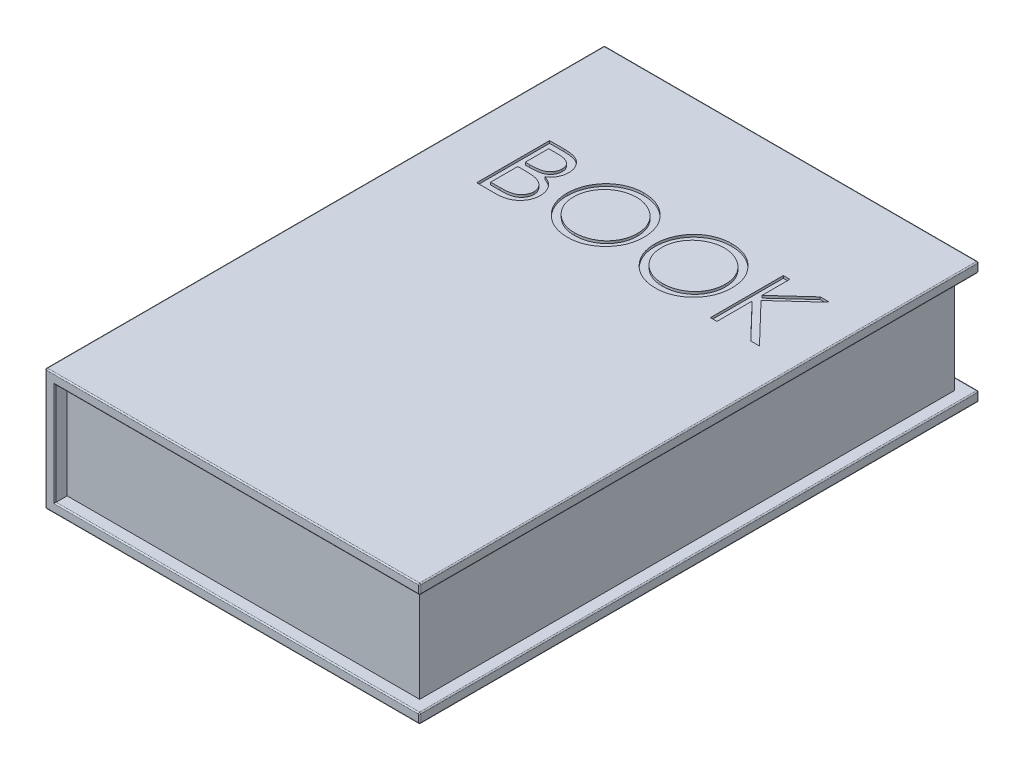
from build123d import *

# Parameters (mm, degrees)
CROQUIS1_W              = 150
CROQUIS1_H              = 230
SALIENTE_EXTRUIR1_DEPTH = 4
CROQUIS2_W              = 230
CROQUIS2_H              = 50
SALIENTE_EXTRUIR2_DEPTH = 4
CROQUIS3_W              = 145
CROQUIS3_H              = 220
SALIENTE_EXTRUIR3_DEPTH = 42
CROQUIS4_W              = 154
CROQUIS4_H              = 230
SALIENTE_EXTRUIR4_DEPTH = 4
REDONDEO1_R             = 0.5
ENVOLVER1_START         = -1
ENVOLVER1_DEPTH         = 1


# Read off the part's stored shape, not the designer's step: Envolver1
with BuildPart() as part:
    # Croquis1 → Saliente-Extruir1 (new body)
    with BuildSketch(Plane(origin=(0, 0, 0), x_dir=(1, 0, 0), z_dir=(0, 1, 0))):
        Rectangle(CROQUIS1_W, CROQUIS1_H)
    extrude(amount=SALIENTE_EXTRUIR1_DEPTH)

    # Croquis2 → Saliente-Extruir2 (add)
    with BuildSketch(Plane.ZY.offset(75)):
        with Locations((0, 25)):
            Rectangle(CROQUIS2_W, CROQUIS2_H)
    extrude(amount=SALIENTE_EXTRUIR2_DEPTH)

    # Croquis4 → Saliente-Extruir4 (add)
    with BuildSketch(Plane(origin=(0, 50, 0), x_dir=(1, 0, 0), z_dir=(0, 1, 0))):
        with Locations((-2, 0)):
            Rectangle(CROQUIS4_W, CROQUIS4_H)
    extrude(amount=-SALIENTE_EXTRUIR4_DEPTH)

    # Redondeo1
    redondeo1_edges = [part.edges().sort_by_distance(p)[0] for p in [
        (0, 4, -115),
        (-75, 25, -115),
        (0, 46, -115),
        (0, 46, 115),
        (-75, 25, 115),
        (0, 4, 115),
        (75, 2, 115),
        (75, 4, 0),
        (75, 2, -115),
        (75, 48, -115),
        (75, 46, 0),
        (75, 48, 115),
        (-79, 25, 115),
        (-79, 25, -115),
        (-2, 0, -115),
        (-79, 0, 0),
        (-2, 0, 115),
        (75, 0, 0),
        (-79, 50, 0),
        (-2, 50, -115),
        (75, 50, 0),
        (-2, 50, 115),
    ]]
    fillet(redondeo1_edges, radius=REDONDEO1_R)

    # Envolver1 outline → Envolver1 (cut)
    # profile 1 of 4: a face of its own
    with BuildSketch(Plane(origin=(0, 50, 0), x_dir=(1, 0, 0), z_dir=(0, 1, 0)).offset(ENVOLVER1_START)):
        with BuildLine():
            add(Edge.make_bspline(
                [(-50.497714302, 69.806907736), (-50.211184489, 69.805401304), (-49.6558184, 69.802481464), (-48.848223185, 69.757197483), (-48.091804808, 69.695451741), (-47.386343902, 69.597479518), (-46.732166453, 69.479264286), (-46.127300991, 69.336105862), (-45.573670943, 69.164449174), (-44.912704631, 68.891481049), (-44.159098966, 68.485853891), (-43.343112743, 67.88646619), (-42.64536212, 67.153330792), (-42.043765115, 66.326336603), (-41.565469804, 65.416601416), (-41.219447255, 64.44580837), (-41.000379752, 63.426479153), (-40.977850316, 62.726680486), (-40.966464302, 62.373013506)],
                knots=[0, 0, 0, 0, 0.062594097, 0.121322939, 0.176680142, 0.228365096, 0.276868446, 0.321879128, 0.364098625, 0.403355696, 0.477967948, 0.550535461, 0.623584457, 0.698174882, 0.77335367, 0.847281125, 0.92281834, 1, 1, 1, 1], degree=3))
            Line((-50.497714302, 69.806907736), (-56.351079687, 69.806907736))
            Line((-56.351079687, 69.806907736), (-56.351079687, 39.806907736))
            Line((-56.351079687, 39.806907736), (-48.238098917, 39.806907736))
            add(Edge.make_bspline(
                [(-38.658771994, 48.322532736), (-38.66714496, 48.029673832), (-38.683619005, 47.453465734), (-38.805161621, 46.606993153), (-39.010953966, 45.798065039), (-39.294420935, 45.021449187), (-39.664383632, 44.278648034), (-40.114623326, 43.568820057), (-40.6514653, 42.899097224), (-41.252004176, 42.262037597), (-41.931393995, 41.689227991), (-42.66438618, 41.179093362), (-43.460211779, 40.759555687), (-44.305800299, 40.407132646), (-45.210637295, 40.137928087), (-46.170659643, 39.94959174), (-47.185039373, 39.822691423), (-47.881122954, 39.812258238), (-48.238098917, 39.806907736)],
                knots=[0, 0, 0, 0, 0.061160277, 0.120334558, 0.178180255, 0.235235126, 0.292682961, 0.351186248, 0.41045661, 0.471719854, 0.533761203, 0.595739024, 0.657887515, 0.72129518, 0.786822515, 0.854686154, 0.925477986, 1, 1, 1, 1], degree=3))
            add(Edge.make_bspline(
                [(-44.434012379, 55.990801967), (-44.093208714, 55.859959119), (-43.441166879, 55.609624339), (-42.543858201, 55.167034647), (-41.77075953, 54.685645129), (-41.11592685, 54.159943557), (-40.555889808, 53.593296607), (-40.066864594, 52.977395628), (-39.649595673, 52.304206275), (-39.292056328, 51.5807474), (-39.013066991, 50.814406243), (-38.804130667, 50.012371019), (-38.684409675, 49.177517689), (-38.66737275, 48.609357295), (-38.658771994, 48.322532736)],
                knots=[0, 0, 0, 0, 0.106057493, 0.202914257, 0.290300165, 0.370222566, 0.446383721, 0.5213969, 0.598291083, 0.676142469, 0.7555287, 0.834887172, 0.916646049, 1, 1, 1, 1], degree=3))
            add(Edge.make_bspline(
                [(-40.966464302, 62.373013506), (-40.975834746, 62.041705885), (-40.994248551, 61.390655168), (-41.170329346, 60.438419946), (-41.445992218, 59.531980927), (-41.829180068, 58.674646195), (-42.327197178, 57.885786654), (-42.917411338, 57.159038659), (-43.629498217, 56.525172456), (-44.163011702, 56.17080472), (-44.434012379, 55.990801967)],
                knots=[0, 0, 0, 0, 0.130569107, 0.256580609, 0.380551617, 0.503622917, 0.625739323, 0.747548582, 0.871766119, 1, 1, 1, 1], degree=3))
        make_face()
        with BuildLine():
            add(Edge.make_bspline(
                [(-49.824637379, 42.883830813), (-49.550189442, 42.887120077), (-49.021227226, 42.893459698), (-48.257502396, 42.91415588), (-47.549647221, 42.961232529), (-46.900891772, 43.035339812), (-46.304230749, 43.115726519), (-45.766821866, 43.223823213), (-45.284308779, 43.347671446), (-44.724814713, 43.539107208), (-44.094784642, 43.83650553), (-43.415834445, 44.284913185), (-42.812181146, 44.819112966), (-42.299564639, 45.437377944), (-41.879453308, 46.109646461), (-41.573835122, 46.822320889), (-41.385342064, 47.56362541), (-41.36252347, 48.069054375), (-41.351079687, 48.322532736)],
                knots=[0, 0, 0, 0, 0.072502489, 0.139738989, 0.201795135, 0.259821934, 0.312205989, 0.360773434, 0.404540343, 0.443698099, 0.516840794, 0.587874336, 0.657965418, 0.728969389, 0.79930772, 0.866635778, 0.933116329, 1, 1, 1, 1], degree=3))
            Line((-49.824637379, 42.883830813), (-53.658771994, 42.883830813))
            Line((-53.658771994, 42.883830813), (-53.658771994, 54.037676967))
            Line((-53.658771994, 54.037676967), (-51.873916225, 54.037676967))
            add(Edge.make_bspline(
                [(-46.260935456, 53.683109659), (-46.406899135, 53.712724665), (-46.723378497, 53.776936105), (-47.239443473, 53.84471642), (-47.828608063, 53.905102647), (-48.492232725, 53.949769713), (-49.231157078, 53.995940086), (-50.046959238, 54.013895696), (-50.936307649, 54.035317925), (-51.553385127, 54.036870505), (-51.873916225, 54.037676967)],
                knots=[0, 0, 0, 0, 0.079306486, 0.171952819, 0.277056507, 0.394730576, 0.526177321, 0.671344767, 0.829285257, 1, 1, 1, 1], degree=3))
            add(Edge.make_bspline(
                [(-41.351079687, 48.322532736), (-41.353446295, 48.481047084), (-41.358141339, 48.795518928), (-41.42894661, 49.257654521), (-41.531922636, 49.705304863), (-41.665049212, 50.139685496), (-41.858930359, 50.552943007), (-42.085272173, 50.953250661), (-42.350655616, 51.341137627), (-42.764177038, 51.831528371), (-43.365651191, 52.396531339), (-44.220280695, 52.94970993), (-45.192043249, 53.39583399), (-45.896850331, 53.585258073), (-46.260935456, 53.683109659)],
                knots=[0, 0, 0, 0, 0.060287398, 0.119602355, 0.177503371, 0.235142664, 0.292132593, 0.350871209, 0.410097863, 0.470731522, 0.594828704, 0.722578824, 0.85669139, 1, 1, 1, 1], degree=3))
        make_face(mode=Mode.SUBTRACT)
        with BuildLine():
            add(Edge.make_bspline(
                [(-51.849877763, 57.114600044), (-51.585459517, 57.118027956), (-51.074549581, 57.124651379), (-50.334664753, 57.143624382), (-49.647878883, 57.196750469), (-49.015377457, 57.249861287), (-48.438156508, 57.336214895), (-47.917494838, 57.43900452), (-47.44522115, 57.547715135), (-46.900596474, 57.732596451), (-46.282828345, 58.005833667), (-45.624258881, 58.429877977), (-45.043677713, 58.934943861), (-44.553416104, 59.517723534), (-44.152174928, 60.159433698), (-43.873485941, 60.84983553), (-43.684509219, 61.571722376), (-43.66743895, 62.0673074), (-43.658771994, 62.318926967)],
                knots=[0, 0, 0, 0, 0.072301034, 0.139700332, 0.202288511, 0.260599533, 0.313190329, 0.361738933, 0.405706476, 0.445539985, 0.518831956, 0.58977824, 0.658867479, 0.728430478, 0.797282704, 0.864815377, 0.931363753, 1, 1, 1, 1], degree=3))
            Line((-51.849877763, 57.114600044), (-53.658771994, 57.114600044))
            Line((-53.658771994, 57.114600044), (-53.658771994, 66.729984659))
            Line((-53.658771994, 66.729984659), (-50.00492584, 66.729984659))
            add(Edge.make_bspline(
                [(-43.658771994, 62.318926967), (-43.66328211, 62.48543358), (-43.672129195, 62.812054484), (-43.744586074, 63.288191805), (-43.867736712, 63.735995398), (-44.025916369, 64.161602058), (-44.246962272, 64.551703631), (-44.507220529, 64.919788166), (-44.821669303, 65.25332061), (-45.179589126, 65.565059167), (-45.591091607, 65.841440834), (-46.055931251, 66.083504518), (-46.580397055, 66.278425461), (-47.155650097, 66.44913534), (-47.790545133, 66.569035001), (-48.477755591, 66.668921181), (-49.222910325, 66.719773255), (-49.738439776, 66.726504937), (-50.00492584, 66.729984659)],
                knots=[0, 0, 0, 0, 0.057003133, 0.111817869, 0.164402372, 0.215869805, 0.26684111, 0.317478963, 0.369902136, 0.423400449, 0.479718398, 0.539241497, 0.602430689, 0.671029546, 0.744484798, 0.823453971, 0.908740313, 1, 1, 1, 1], degree=3))
        make_face(mode=Mode.SUBTRACT)
    # profile 2 of 4: a face of its own
    with BuildSketch(Plane(origin=(0, 50, 0), x_dir=(1, 0, 0), z_dir=(0, 1, 0)).offset(ENVOLVER1_START)):
        with BuildLine():
            add(Edge.make_bspline(
                [(-2.50492584, 54.818926967), (-2.518210976, 54.279291713), (-2.544397518, 53.215608109), (-2.768701326, 51.654378587), (-3.120481326, 50.153601189), (-3.622735036, 48.715781308), (-4.267524851, 47.33940219), (-5.061712032, 46.028085443), (-5.997208124, 44.781401171), (-7.061838276, 43.613006897), (-8.222418636, 42.541600006), (-9.467249494, 41.608009643), (-10.768335094, 40.804660003), (-12.142418307, 40.163657084), (-13.571275765, 39.651326337), (-15.067695677, 39.302018079), (-16.62466614, 39.076700566), (-17.686417602, 39.050827572), (-18.226079687, 39.037676967)],
                knots=[0, 0, 0, 0, 0.065226504, 0.128568996, 0.190320378, 0.251377989, 0.312387528, 0.373788704, 0.43643116, 0.500566755, 0.564686795, 0.627135518, 0.688455409, 0.749245746, 0.810155177, 0.871670926, 0.934773496, 1, 1, 1, 1], degree=3))
            add(Edge.make_bspline(
                [(-18.466464302, 70.576138506), (-17.910966251, 70.562068682), (-16.819922249, 70.534434389), (-15.216423125, 70.322899216), (-13.685608023, 69.95693873), (-12.215006833, 69.469541737), (-10.822209891, 68.819361291), (-9.49673367, 68.033488591), (-8.241731894, 67.103690373), (-7.074120053, 66.037154143), (-6.005631907, 64.876724538), (-5.064267168, 63.638342452), (-4.275333222, 62.329495575), (-3.627455046, 60.954117027), (-3.119181249, 59.515317301), (-2.768446588, 58.005425849), (-2.544405301, 56.434225648), (-2.518212924, 55.362566808), (-2.50492584, 54.818926967)],
                knots=[0, 0, 0, 0, 0.066570035, 0.130749041, 0.1934128, 0.254989399, 0.316113556, 0.377261758, 0.439400784, 0.502970589, 0.566524976, 0.628231103, 0.689090611, 0.749344669, 0.810169593, 0.871609824, 0.934869184, 1, 1, 1, 1], degree=3))
            add(Edge.make_bspline(
                [(-34.043387379, 54.674696198), (-34.038804789, 55.031547648), (-34.02969742, 55.740748706), (-33.920054342, 56.793890993), (-33.760954046, 57.830096631), (-33.532937652, 58.846419042), (-33.234723364, 59.84037034), (-32.882848844, 60.81880545), (-32.45307874, 61.771808796), (-31.967244614, 62.703895011), (-31.425000546, 63.600534204), (-30.82606555, 64.448073488), (-30.191476678, 65.253624889), (-29.495790447, 65.996313493), (-28.761935202, 66.697744834), (-27.978006247, 67.347139551), (-27.148787009, 67.950353416), (-26.270709468, 68.49395634), (-25.365409969, 68.985606065), (-24.432180446, 69.407507645), (-23.483695547, 69.769616744), (-22.515512851, 70.063109531), (-21.530203376, 70.294812697), (-20.525616651, 70.452590014), (-19.502552997, 70.562512739), (-18.81331312, 70.571577042), (-18.466464302, 70.576138506)],
                knots=[0, 0, 0, 0, 0.043208986, 0.085872872, 0.128120007, 0.170151964, 0.211917621, 0.253753003, 0.296006409, 0.338443357, 0.381015368, 0.422820479, 0.464089056, 0.505125849, 0.545974971, 0.586985211, 0.628338592, 0.670083802, 0.711991602, 0.753039155, 0.794049395, 0.834885543, 0.875498313, 0.9165473, 0.958003779, 1, 1, 1, 1], degree=3))
            add(Edge.make_bspline(
                [(-18.226079687, 39.037676967), (-18.769716706, 39.050957426), (-19.841369986, 39.077136745), (-21.414544575, 39.301548786), (-22.925496665, 39.652474248), (-24.36990539, 40.153983701), (-25.748576215, 40.802131393), (-27.064205495, 41.592454642), (-28.311512471, 42.530230138), (-29.480156013, 43.594515063), (-30.549434854, 44.753128366), (-31.481658074, 45.994564838), (-32.272159046, 47.294468752), (-32.918130467, 48.65644753), (-33.429540119, 50.073917039), (-33.77843856, 51.55633256), (-34.004175292, 53.09524261), (-34.030188262, 54.143038881), (-34.043387379, 54.674696198)],
                knots=[0, 0, 0, 0, 0.065818877, 0.129746527, 0.192071954, 0.253459424, 0.314569588, 0.376279881, 0.439025654, 0.503267029, 0.567492823, 0.629704796, 0.690999649, 0.751451651, 0.812004364, 0.873149681, 0.935635484, 1, 1, 1, 1], degree=3))
        make_face()
        with BuildLine():
            add(Edge.make_bspline(
                [(-31.351079687, 54.686715429), (-31.340152298, 54.253324965), (-31.318654745, 53.400711848), (-31.130447001, 52.151270615), (-30.840544363, 50.950513875), (-30.413195508, 49.805011795), (-29.878761668, 48.704917942), (-29.21853118, 47.659991331), (-28.436310447, 46.66994955), (-27.547765933, 45.741704388), (-26.576428448, 44.894454637), (-25.545005048, 44.150768277), (-24.464545556, 43.521537565), (-23.332232389, 43.008922658), (-22.154110626, 42.602724906), (-20.92258876, 42.324336639), (-19.645870535, 42.14111845), (-18.775607777, 42.123523399), (-18.334252763, 42.114600044)],
                knots=[0, 0, 0, 0, 0.064503999, 0.126899322, 0.18774654, 0.248149733, 0.308586065, 0.369583005, 0.431826965, 0.496179723, 0.560667855, 0.623504455, 0.685260411, 0.746536822, 0.808327352, 0.870486188, 0.934316883, 1, 1, 1, 1], degree=3))
            add(Edge.make_bspline(
                [(-18.334252763, 67.499215429), (-18.618949622, 67.495744941), (-19.185621619, 67.488837143), (-20.028060501, 67.397845295), (-20.859419934, 67.268160533), (-21.67987161, 67.083176069), (-22.485982662, 66.831141331), (-23.285267014, 66.541076404), (-24.070436048, 66.18775277), (-24.838897686, 65.788558161), (-25.583884045, 65.346710268), (-26.286850057, 64.858380837), (-26.949615577, 64.3350218), (-27.570557863, 63.775411766), (-28.147853624, 63.176700893), (-28.692865351, 62.547965726), (-29.183747479, 61.871235232), (-29.633623852, 61.164860316), (-30.03620534, 60.429761048), (-30.394194095, 59.673676515), (-30.687028456, 58.890439199), (-30.925848824, 58.08854642), (-31.123847203, 57.269268194), (-31.249280838, 56.42638949), (-31.34127249, 55.564145673), (-31.347785451, 54.981444067), (-31.351079687, 54.686715429)],
                knots=[0, 0, 0, 0, 0.042023329, 0.083644911, 0.124983795, 0.166247461, 0.207701556, 0.249631071, 0.29174177, 0.334742875, 0.377460169, 0.419556319, 0.461044176, 0.502096284, 0.542890714, 0.583800819, 0.624863583, 0.666224689, 0.707399186, 0.748556678, 0.789654591, 0.830739726, 0.872070142, 0.913993395, 0.95649813, 1, 1, 1, 1], degree=3))
            add(Edge.make_bspline(
                [(-5.197233533, 54.824936583), (-5.200671644, 55.115640905), (-5.207491771, 55.692306478), (-5.297855839, 56.544827778), (-5.427292042, 57.378426733), (-5.61382954, 58.189830759), (-5.854259429, 58.979246688), (-6.150722261, 59.745933097), (-6.500310542, 60.492746198), (-6.901523894, 61.217840172), (-7.352516667, 61.913623641), (-7.845324466, 62.578787177), (-8.388456022, 63.200839245), (-8.966393378, 63.795136622), (-9.593572395, 64.349004248), (-10.267152059, 64.862625853), (-10.978955011, 65.348396776), (-11.732617029, 65.786615877), (-12.510422346, 66.191309301), (-13.308541986, 66.538032185), (-14.117934269, 66.832650351), (-14.936540946, 67.083938623), (-15.771252189, 67.267436024), (-16.616427865, 67.397962166), (-17.470898652, 67.488805473), (-18.045554821, 67.495734432), (-18.334252763, 67.499215429)],
                knots=[0, 0, 0, 0, 0.042915082, 0.085129971, 0.126473319, 0.167453038, 0.207976333, 0.248249378, 0.288749987, 0.329669857, 0.370537287, 0.411128564, 0.451818913, 0.492405877, 0.533485862, 0.575263062, 0.617440613, 0.660671688, 0.703940204, 0.746867522, 0.7890793, 0.831104042, 0.87323799, 0.91516577, 0.957380658, 1, 1, 1, 1], degree=3))
            add(Edge.make_bspline(
                [(-18.334252763, 42.114600044), (-18.037599892, 42.118675796), (-17.449248152, 42.126759236), (-16.574143675, 42.208176466), (-15.714804717, 42.338735346), (-14.872436604, 42.526712394), (-14.047995363, 42.761974164), (-13.238039908, 43.041468975), (-12.45119742, 43.390165006), (-11.677541667, 43.775433163), (-10.937002453, 44.214634513), (-10.230069319, 44.686390082), (-9.57456092, 45.208978259), (-8.954083165, 45.760273795), (-8.374417259, 46.351392491), (-7.839483109, 46.981565821), (-7.351081976, 47.654771455), (-6.901376434, 48.360074932), (-6.50020561, 49.09718567), (-6.150670475, 49.856011481), (-5.85413234, 50.634683847), (-5.614745155, 51.434325888), (-5.427155484, 52.253418877), (-5.297899027, 53.093059547), (-5.207483839, 53.951568197), (-5.200668892, 54.53222982), (-5.197233533, 54.824936583)],
                knots=[0, 0, 0, 0, 0.043633218, 0.086537777, 0.129177336, 0.171436324, 0.213415895, 0.255265955, 0.297369481, 0.339940748, 0.382347459, 0.423952947, 0.464871163, 0.505572294, 0.546002577, 0.586567975, 0.627064799, 0.668270684, 0.709549225, 0.750428154, 0.791096194, 0.832027145, 0.873135955, 0.914610764, 0.956955986, 1, 1, 1, 1], degree=3))
        make_face(mode=Mode.SUBTRACT)
    # profile 3 of 4: a face of its own
    with BuildSketch(Plane(origin=(0, 50, 0), x_dir=(1, 0, 0), z_dir=(0, 1, 0)).offset(ENVOLVER1_START)):
        with BuildLine():
            add(Edge.make_bspline(
                [(33.648920313, 54.818926967), (33.635635178, 54.279291713), (33.609448636, 53.215608109), (33.385144828, 51.654378587), (33.033364828, 50.153601189), (32.531111118, 48.715781308), (31.886321303, 47.33940219), (31.092134122, 46.028085443), (30.15663803, 44.781401171), (29.092007878, 43.613006897), (27.931427518, 42.541600006), (26.686596659, 41.608009643), (25.38551106, 40.804660003), (24.011427847, 40.163657084), (22.582570389, 39.651326337), (21.086150477, 39.302018079), (19.529180013, 39.076700566), (18.467428552, 39.050827572), (17.927766467, 39.037676967)],
                knots=[0, 0, 0, 0, 0.065226504, 0.128568996, 0.190320378, 0.251377989, 0.312387528, 0.373788704, 0.43643116, 0.500566755, 0.564686795, 0.627135518, 0.688455409, 0.749245746, 0.810155177, 0.871670926, 0.934773496, 1, 1, 1, 1], degree=3))
            add(Edge.make_bspline(
                [(17.687381852, 70.576138506), (18.242879903, 70.562068682), (19.333923905, 70.534434389), (20.937423028, 70.322899216), (22.468238131, 69.95693873), (23.938839321, 69.469541737), (25.331636263, 68.819361291), (26.657112484, 68.033488591), (27.91211426, 67.103690373), (29.079726101, 66.037154143), (30.148214247, 64.876724538), (31.089578986, 63.638342452), (31.878512932, 62.329495575), (32.526391108, 60.954117027), (33.034664905, 59.515317301), (33.385399566, 58.005425849), (33.609440853, 56.434225648), (33.63563323, 55.362566808), (33.648920313, 54.818926967)],
                knots=[0, 0, 0, 0, 0.066570035, 0.130749041, 0.1934128, 0.254989399, 0.316113556, 0.377261758, 0.439400784, 0.502970589, 0.566524976, 0.628231103, 0.689090611, 0.749344669, 0.810169593, 0.871609824, 0.934869184, 1, 1, 1, 1], degree=3))
            add(Edge.make_bspline(
                [(2.110458775, 54.674696198), (2.115041365, 55.031547648), (2.124148734, 55.740748706), (2.233791812, 56.793890993), (2.392892108, 57.830096631), (2.620908501, 58.846419042), (2.91912279, 59.84037034), (3.27099731, 60.81880545), (3.700767413, 61.771808796), (4.186601539, 62.703895011), (4.728845608, 63.600534204), (5.327780603, 64.448073488), (5.962369476, 65.253624889), (6.658055707, 65.996313493), (7.391910952, 66.697744834), (8.175839907, 67.347139551), (9.005059145, 67.950353416), (9.883136685, 68.49395634), (10.788436184, 68.985606065), (11.721665708, 69.407507645), (12.670150607, 69.769616744), (13.638333303, 70.063109531), (14.623642778, 70.294812697), (15.628229503, 70.452590014), (16.651293157, 70.562512739), (17.340533034, 70.571577042), (17.687381852, 70.576138506)],
                knots=[0, 0, 0, 0, 0.043208986, 0.085872872, 0.128120007, 0.170151964, 0.211917621, 0.253753003, 0.296006409, 0.338443357, 0.381015368, 0.422820479, 0.464089056, 0.505125849, 0.545974971, 0.586985211, 0.628338592, 0.670083802, 0.711991602, 0.753039155, 0.794049395, 0.834885543, 0.875498313, 0.9165473, 0.958003779, 1, 1, 1, 1], degree=3))
            add(Edge.make_bspline(
                [(17.927766467, 39.037676967), (17.384129447, 39.050957426), (16.312476168, 39.077136745), (14.739301579, 39.301548786), (13.228349489, 39.652474248), (11.783940764, 40.153983701), (10.405269939, 40.802131393), (9.089640659, 41.592454642), (7.842333683, 42.530230138), (6.673690141, 43.594515063), (5.6044113, 44.753128366), (4.672188079, 45.994564838), (3.881687108, 47.294468752), (3.235715687, 48.65644753), (2.724306035, 50.073917039), (2.375407594, 51.55633256), (2.149670862, 53.09524261), (2.123657892, 54.143038881), (2.110458775, 54.674696198)],
                knots=[0, 0, 0, 0, 0.065818877, 0.129746527, 0.192071954, 0.253459424, 0.314569588, 0.376279881, 0.439025654, 0.503267029, 0.567492823, 0.629704796, 0.690999649, 0.751451651, 0.812004364, 0.873149681, 0.935635484, 1, 1, 1, 1], degree=3))
        make_face()
        with BuildLine():
            add(Edge.make_bspline(
                [(4.802766467, 54.686715429), (4.813693856, 54.253324965), (4.835191409, 53.400711848), (5.023399152, 52.151270615), (5.313301791, 50.950513875), (5.740650646, 49.805011795), (6.275084486, 48.704917942), (6.935314974, 47.659991331), (7.717535707, 46.66994955), (8.606080221, 45.741704388), (9.577417706, 44.894454637), (10.608841106, 44.150768277), (11.689300598, 43.521537565), (12.821613764, 43.008922658), (13.999735527, 42.602724906), (15.231257394, 42.324336639), (16.507975619, 42.14111845), (17.378238377, 42.123523399), (17.81959339, 42.114600044)],
                knots=[0, 0, 0, 0, 0.064503999, 0.126899322, 0.18774654, 0.248149733, 0.308586065, 0.369583005, 0.431826965, 0.496179723, 0.560667855, 0.623504455, 0.685260411, 0.746536822, 0.808327352, 0.870486188, 0.934316883, 1, 1, 1, 1], degree=3))
            add(Edge.make_bspline(
                [(17.81959339, 67.499215429), (17.534896531, 67.495744941), (16.968224535, 67.488837143), (16.125785653, 67.397845295), (15.29442622, 67.268160533), (14.473974544, 67.083176069), (13.667863492, 66.831141331), (12.868579139, 66.541076404), (12.083410106, 66.18775277), (11.314948467, 65.788558161), (10.569962109, 65.346710268), (9.866996097, 64.858380837), (9.204230577, 64.3350218), (8.583288291, 63.775411766), (8.00599253, 63.176700893), (7.460980803, 62.547965726), (6.970098675, 61.871235232), (6.520222302, 61.164860316), (6.117640814, 60.429761048), (5.759652059, 59.673676515), (5.466817698, 58.890439199), (5.22799733, 58.08854642), (5.029998951, 57.269268194), (4.904565316, 56.42638949), (4.812573664, 55.564145673), (4.806060702, 54.981444067), (4.802766467, 54.686715429)],
                knots=[0, 0, 0, 0, 0.042023329, 0.083644911, 0.124983795, 0.166247461, 0.207701556, 0.249631071, 0.29174177, 0.334742875, 0.377460169, 0.419556319, 0.461044176, 0.502096284, 0.542890714, 0.583800819, 0.624863583, 0.666224689, 0.707399186, 0.748556678, 0.789654591, 0.830739726, 0.872070142, 0.913993395, 0.95649813, 1, 1, 1, 1], degree=3))
            add(Edge.make_bspline(
                [(30.956612621, 54.824936583), (30.95317451, 55.115640905), (30.946354383, 55.692306478), (30.855990315, 56.544827778), (30.726554112, 57.378426733), (30.540016614, 58.189830759), (30.299586725, 58.979246688), (30.003123893, 59.745933097), (29.653535612, 60.492746198), (29.25232226, 61.217840172), (28.801329487, 61.913623641), (28.308521688, 62.578787177), (27.765390132, 63.200839245), (27.187452776, 63.795136622), (26.560273759, 64.349004248), (25.886694095, 64.862625853), (25.174891143, 65.348396776), (24.421229125, 65.786615877), (23.643423807, 66.191309301), (22.845304168, 66.538032185), (22.035911885, 66.832650351), (21.217305208, 67.083938623), (20.382593965, 67.267436024), (19.537418289, 67.397962166), (18.682947502, 67.488805473), (18.108291332, 67.495734432), (17.81959339, 67.499215429)],
                knots=[0, 0, 0, 0, 0.042915082, 0.085129971, 0.126473319, 0.167453038, 0.207976333, 0.248249378, 0.288749987, 0.329669857, 0.370537287, 0.411128564, 0.451818913, 0.492405877, 0.533485862, 0.575263062, 0.617440613, 0.660671688, 0.703940204, 0.746867522, 0.7890793, 0.831104042, 0.87323799, 0.91516577, 0.957380658, 1, 1, 1, 1], degree=3))
            add(Edge.make_bspline(
                [(17.81959339, 42.114600044), (18.116246261, 42.118675796), (18.704598002, 42.126759236), (19.579702479, 42.208176466), (20.439041437, 42.338735346), (21.28140955, 42.526712394), (22.10585079, 42.761974164), (22.915806246, 43.041468975), (23.702648734, 43.390165006), (24.476304487, 43.775433163), (25.216843701, 44.214634513), (25.923776835, 44.686390082), (26.579285234, 45.208978259), (27.199762989, 45.760273795), (27.779428895, 46.351392491), (28.314363045, 46.981565821), (28.802764178, 47.654771455), (29.25246972, 48.360074932), (29.653640544, 49.09718567), (30.003175678, 49.856011481), (30.299713814, 50.634683847), (30.539100998, 51.434325888), (30.72669067, 52.253418877), (30.855947126, 53.093059547), (30.946362315, 53.951568197), (30.953177262, 54.53222982), (30.956612621, 54.824936583)],
                knots=[0, 0, 0, 0, 0.043633218, 0.086537777, 0.129177336, 0.171436324, 0.213415895, 0.255265955, 0.297369481, 0.339940748, 0.382347459, 0.423952947, 0.464871163, 0.505572294, 0.546002577, 0.586567975, 0.627064799, 0.668270684, 0.709549225, 0.750428154, 0.791096194, 0.832027145, 0.873135955, 0.914610764, 0.956955986, 1, 1, 1, 1], degree=3))
        make_face(mode=Mode.SUBTRACT)
    # profile 4 of 4: a face of its own
    with BuildSketch(Plane(origin=(0, 50, 0), x_dir=(1, 0, 0), z_dir=(0, 1, 0)).offset(ENVOLVER1_START)):
        Polygon((42.49507416, 54.284071198), (56.407333775, 39.806907736), (59.99507416, 39.806907736), (44.099641467, 56.345369275), (58.841228006, 69.806907736), (55.001083775, 69.806907736), (42.49507416, 58.38262889), (42.49507416, 69.806907736), (39.802766467, 69.806907736), (39.802766467, 39.806907736), (42.49507416, 39.806907736), align=None)
    extrude(amount=ENVOLVER1_DEPTH, mode=Mode.SUBTRACT)


with BuildPart() as body_2:
    # Croquis3 → Saliente-Extruir3 (new body)
    with BuildSketch(Plane(origin=(0, 4, 0), x_dir=(1, 0, 0), z_dir=(0, 1, 0))):
        with Locations((-2.5, 0)):
            Rectangle(CROQUIS3_W, CROQUIS3_H)
    extrude(amount=SALIENTE_EXTRUIR3_DEPTH)


solid = Compound([part.part, body_2.part])
